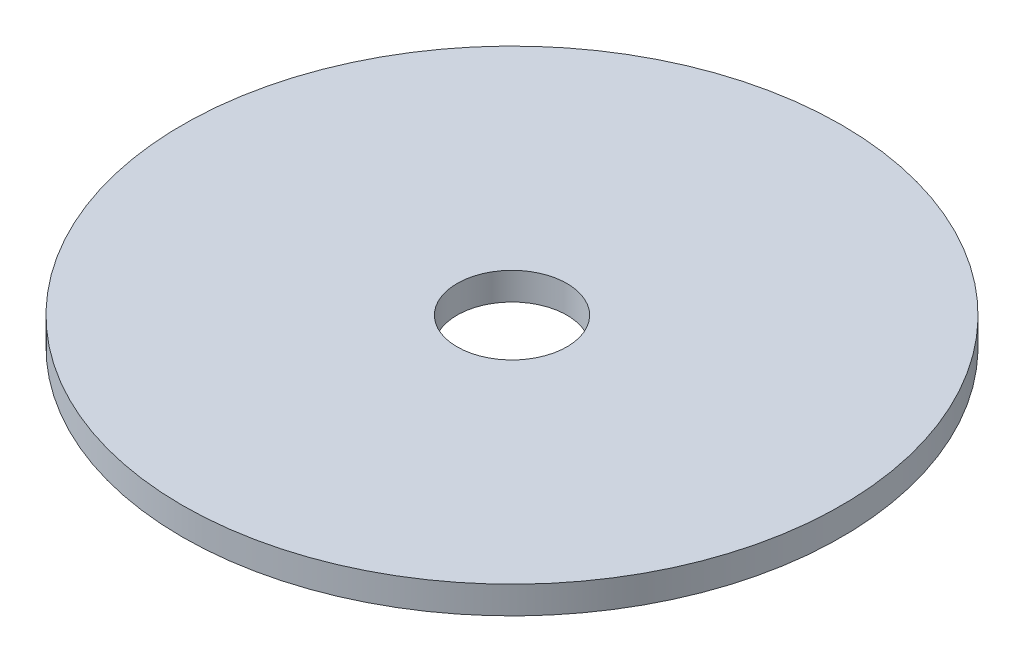
from build123d import *

# Parameters (mm, degrees)
SKETCH1_R           = 38.1
BOSS_EXTRUDE1_DEPTH = 3.175
SKETCH2_R           = 6.35
CUT_EXTRUDE1_DEPTH  = 54.975


with BuildPart() as part:
    # Sketch1 → Boss-Extrude1 (new body)
    with BuildSketch(Plane(origin=(0, 0, 0), x_dir=(1, 0, 0), z_dir=(0, 1, 0))):
        Circle(SKETCH1_R)
    extrude(amount=BOSS_EXTRUDE1_DEPTH)

    # Sketch2 → Cut-Extrude1 (cut, through all)
    with BuildSketch(Plane(origin=(0, 3.175, 0), x_dir=(1, 0, 0), z_dir=(0, 1, 0))):
        Circle(SKETCH2_R)
    extrude(amount=-CUT_EXTRUDE1_DEPTH, mode=Mode.SUBTRACT)


solid = part.part
